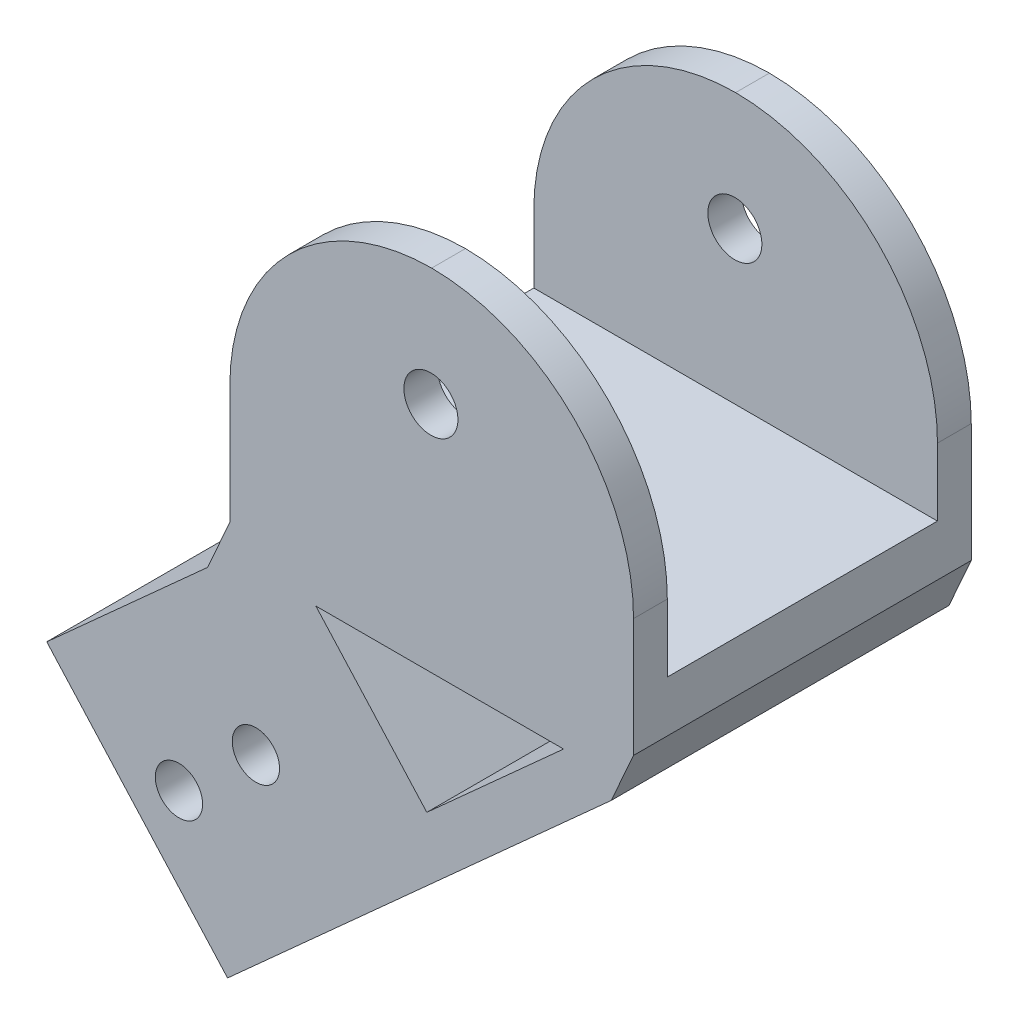
from build123d import *

# Parameters (mm, degrees)
BOSS_EXTRUDE4_DEPTH = 50
SKETCH6_W           = 59.76747767
SKETCH6_H           = 50
BOSS_EXTRUDE5_DEPTH = 52
SKETCH7_W           = 50
SKETCH7_H           = 40
CUT_EXTRUDE2_DEPTH  = 50
SKETCH9_R           = 16
CUT_EXTRUDE3_DEPTH  = 39
SKETCH10_W          = 59.76747767
SKETCH10_H          = 40
CUT_EXTRUDE4_DEPTH  = 50
CUT_EXTRUDE5_REACH  = 133.427
SKETCH11_R          = 4
CUT_EXTRUDE6_REACH  = 133.427
SKETCH12_R          = 3.5
FILLET2_R           = 30
SKETCH17_W          = 59.76747767
SKETCH17_H          = 40
BOSS_EXTRUDE8_DEPTH = 10
CUT_EXTRUDE8_DEPTH  = 50


with BuildPart() as part:
    # Sketch5 → Boss-Extrude4 (new body)
    with BuildSketch(Plane.XY):
        Polygon((0, 53.833769989), (59.76747767, 53.833769989), (-37.490513215, -33.76845977), (-64.260925192, -4.047338616), align=None)
    extrude(amount=BOSS_EXTRUDE4_DEPTH)

    # Sketch6 → Boss-Extrude5 (add)
    with BuildSketch(Plane(origin=(0, 53.833769989, 0), x_dir=(1, 0, 0), z_dir=(0, 1, 0))):
        with Locations((29.883738835, -25)):
            Rectangle(SKETCH6_W, SKETCH6_H)
    extrude(amount=BOSS_EXTRUDE5_DEPTH)

    # Sketch7 → Cut-Extrude2 (cut)
    with BuildSketch(Plane(origin=(-37.490513215, -33.768459769, 0), x_dir=(0, 0, 1), z_dir=(-0.7430280288371722, -0.6692602994069995, 0))):
        with Locations((25, 20)):
            Rectangle(SKETCH7_W, SKETCH7_H)
    extrude(amount=-CUT_EXTRUDE2_DEPTH, mode=Mode.SUBTRACT)

    # Sketch9 → Cut-Extrude3 (cut)
    with BuildSketch(Plane(origin=(-0.339111773, -0.305444799, 0), x_dir=(0, 0, 1), z_dir=(-0.743028028837172, -0.6692602994069997, 0))):
        with Locations(Location((25, 20, 0), (0, 0, 270))):
            Circle(SKETCH9_R)
    extrude(amount=-CUT_EXTRUDE3_DEPTH, mode=Mode.SUBTRACT)

    # Sketch10 → Cut-Extrude4 (cut)
    with BuildSketch(Plane(origin=(0, 105.833769989, 0), x_dir=(1, 0, 0), z_dir=(0, 1, 0))):
        with Locations((29.883738835, -25)):
            Rectangle(SKETCH10_W, SKETCH10_H)
    extrude(amount=-CUT_EXTRUDE4_DEPTH, mode=Mode.SUBTRACT)

    # Cut-Extrude5: up to this face of the body (flat: up to its plane)
    cut_extrude5_end = Plane(part.part.faces().sort_by_distance((21.675181221, 59.791215604, 0))[0])
    # Sketch11 → Cut-Extrude5 (cut, up to the picked face)
    with BuildSketch(Plane.XY.offset(50), mode=Mode.PRIVATE) as cut_extrude5_sk1:
        with Locations(Location((29.76747767, 88.333769989, 0), (0, 0, 180))):
            Circle(SKETCH11_R)
    cut_extrude5_tool1 = split(extrude(cut_extrude5_sk1.sketch, amount=-CUT_EXTRUDE5_REACH, mode=Mode.PRIVATE), bisect_by=cut_extrude5_end, keep=Keep.BOTH, mode=Mode.PRIVATE)
    add(cut_extrude5_tool1.solids().sort_by(Axis((29.767478, 88.33377, 50), (0, 0, -1)))[0], mode=Mode.SUBTRACT)

    # Cut-Extrude6: up to this face of the body (flat: up to its plane)
    cut_extrude6_end = Plane(part.part.faces().sort_by_distance((21.599927582, 59.525786489, 0))[0])
    # Sketch12 → Cut-Extrude6 (cut, up to the picked face)
    with BuildSketch(Plane.XY.offset(50), mode=Mode.PRIVATE) as cut_extrude6_sk1:
        with Locations((3.855725401, 30.389814462)):
            Circle(SKETCH12_R)
    cut_extrude6_tool1 = split(extrude(cut_extrude6_sk1.sketch, amount=-CUT_EXTRUDE6_REACH, mode=Mode.PRIVATE), bisect_by=cut_extrude6_end, keep=Keep.BOTH, mode=Mode.PRIVATE)
    # Sketch12 → Cut-Extrude6 (cut, up to the picked face)
    with BuildSketch(Plane.XY.offset(50), mode=Mode.PRIVATE) as cut_extrude6_sk2:
        with Locations((-7.534894281, 20.130054072)):
            Circle(SKETCH12_R)
    cut_extrude6_tool2 = split(extrude(cut_extrude6_sk2.sketch, amount=-CUT_EXTRUDE6_REACH, mode=Mode.PRIVATE), bisect_by=cut_extrude6_end, keep=Keep.BOTH, mode=Mode.PRIVATE)
    add(cut_extrude6_tool1.solids().sort_by(Axis((3.855725, 30.389814, 50), (0, 0, -1)))[0], mode=Mode.SUBTRACT)
    add(cut_extrude6_tool2.solids().sort_by(Axis((-7.534894, 20.130054, 50), (0, 0, -1)))[0], mode=Mode.SUBTRACT)

    # Fillet2
    # the kernel refuses this fillet: 30 mm, written as the material it takes off along each edge
    with BuildSketch(Plane(origin=(59.76747767, 105.833769989, 125), x_dir=(0, -1, 0), z_dir=(0, 0, -1)), Plane(origin=(0, 105.833769989, -30), x_dir=(0, -1, 0), z_dir=(0, 0, 1)), Plane(origin=(59.76747767, 105.833769989, 80), x_dir=(0, -1, 0), z_dir=(0, 0, -1))) as fillet2_piece_1:
        with BuildLine():
            CenterArc((FILLET2_R, FILLET2_R), FILLET2_R, 180, 90)
            Line((0, FILLET2_R), (0, 0))
            Line((0, 0), (FILLET2_R, 0))
        make_face()
    extrude(amount=155, mode=Mode.SUBTRACT)
    with BuildSketch(Plane(origin=(0, 105.833769989, -75), x_dir=(1, 0, 0), z_dir=(0, 0, 1))) as fillet2_piece_2:
        with BuildLine():
            CenterArc((FILLET2_R, -FILLET2_R), FILLET2_R, 90, 90)
            Line((0, -FILLET2_R), (0, 0))
            Line((0, 0), (FILLET2_R, 0))
        make_face()
    extrude(amount=155, mode=Mode.SUBTRACT)

    # Sketch17 → Boss-Extrude8 (add)
    with BuildSketch(Plane(origin=(0, 55.833769989, 0), x_dir=(1, 0, 0), z_dir=(0, 1, 0))):
        with Locations((29.883738835, -25)):
            Rectangle(SKETCH17_W, SKETCH17_H)
    extrude(amount=BOSS_EXTRUDE8_DEPTH)

    # Chamfer5
    # the kernel refuses this chamfer: 10 mm, written as the material it adds along each edge
    with BuildSketch(Plane(origin=(0, 53.833769989, 0), x_dir=(0.03375152736497673, 0.9994302548955236, 0), z_dir=(0, 0, 1))) as chamfer5_piece_1:
        with BuildLine():
            Line((4.819419462, 0), (-3.459685747, 3.355201705))
            Line((-3.459685747, 3.355201705), (-3.603688974, 3.216410241))
            ThreePointArc((-3.603688974, 3.216410241), (-1.815286192, 1.595249898), (-0.144003227, -0.138791464))
            Line((-0.144003227, -0.138791464), (0.006750305, -0.199886051))
            ThreePointArc((0.006750305, -0.199886051), (2.413714978, -0.118601005), (4.826169768, -0.199886051))
            Line((4.826169768, -0.199886051), (4.819419462, 0))
        make_face()
    extrude(amount=50)

    # Chamfer6
    # the kernel refuses this chamfer: 10 mm, written as the material it takes off along each edge
    with BuildSketch(Plane(origin=(59.76747767, 53.833769989, -12.048548655), x_dir=(0.03375152736497822, 0.9994302548955234, 0), z_dir=(0, 0, 1))) as chamfer6_piece_1:
        with BuildLine():
            Line((4.819419462, 0), (-3.459685747, 3.355201705))
            Line((-3.459685747, 3.355201705), (-3.603688974, 3.216410241))
            ThreePointArc((-3.603688974, 3.216410241), (-1.815286192, 1.595249898), (-0.144003227, -0.138791464))
            Line((-0.144003227, -0.138791464), (0.006750305, -0.199886051))
            ThreePointArc((0.006750305, -0.199886051), (2.413714978, -0.118601005), (4.826169768, -0.199886051))
            Line((4.826169768, -0.199886051), (4.819419462, 0))
        make_face()
    extrude(amount=74.097097311, mode=Mode.SUBTRACT)

    # Sketch18 → Cut-Extrude8 (cut)
    with BuildSketch(Plane(origin=(0, 0, 0), x_dir=(-1, 0, 0), z_dir=(0, 0, -1))):
        Polygon((-29.160349369, 35.686223292), (-49.412180648, 53.927455304), (-12.730104581, 53.927455304), align=None)
    extrude(amount=-CUT_EXTRUDE8_DEPTH, mode=Mode.SUBTRACT)


solid = part.part
